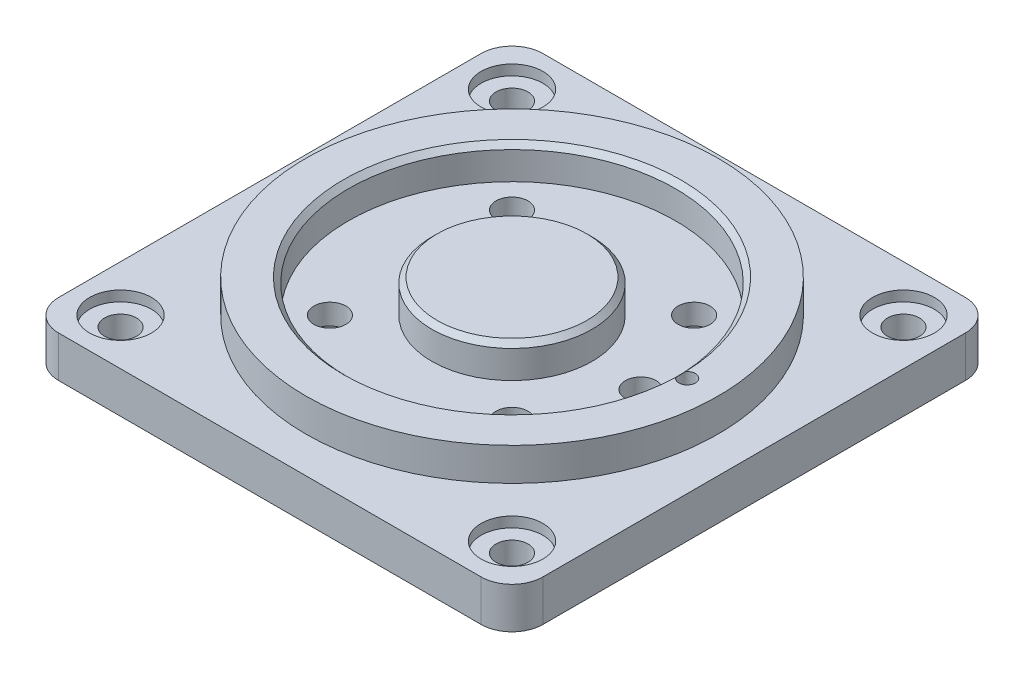
from build123d import *

# Parameters (mm, degrees)
SKETCH1_W           = 94
SKETCH1_H           = 94
SKETCH1_R           = 1.6
SKETCH1_R_2         = 3.1
SKETCH1_R_3         = 3
BOSS_EXTRUDE1_DEPTH = 8
SKETCH2_R           = 7
CUT_EXTRUDE1_DEPTH  = 4
SKETCH3_R           = 40
SKETCH3_R_2         = 1.6
SKETCH3_R_3         = 31.75
SKETCH3_R_4         = 15.55
BOSS_EXTRUDE2_DEPTH = 6.4
CHAMFER1_SIZE       = 1
FILLET1_R           = 6
SKETCH5_R           = 3.1
CUT_EXTRUDE2_DEPTH  = 67.947740825
SKETCH6_R           = 6
CUT_EXTRUDE3_DEPTH  = 2


with BuildPart() as part:
    # Sketch1 → Boss-Extrude1 (new body)
    with BuildSketch(Plane(origin=(0, 0, 0), x_dir=(1, 0, 0), z_dir=(0, 1, 0))):
        Rectangle(SKETCH1_W, SKETCH1_H)
        with Locations(Location((34, 0, 0), (0, 0, 270))):
            Circle(SKETCH1_R, mode=Mode.SUBTRACT)
        with Locations(Location((17.67766953, -17.67766953, 0), (0, 0, 270))):
            Circle(SKETCH1_R_2, mode=Mode.SUBTRACT)
        with Locations(Location((25, 0, 0), (0, 0, 270))):
            Circle(SKETCH1_R_3, mode=Mode.SUBTRACT)
        with Locations(Location((-17.67766953, -17.67766953, 0), (0, 0, 270))):
            Circle(SKETCH1_R_2, mode=Mode.SUBTRACT)
        with Locations(Location((-17.67766953, 17.67766953, 0), (0, 0, 270))):
            Circle(SKETCH1_R_2, mode=Mode.SUBTRACT)
        with Locations(Location((17.67766953, 17.67766953, 0), (0, 0, 270))):
            Circle(SKETCH1_R_2, mode=Mode.SUBTRACT)
    extrude(amount=BOSS_EXTRUDE1_DEPTH)

    # Sketch2 → Cut-Extrude1 (cut)
    with BuildSketch(Plane.XZ):
        with Locations(Location((17.67766953, 17.67766953, 0), (0, 0, 270))):
            Circle(SKETCH2_R)
        with Locations(Location((17.67766953, -17.67766953, 0), (0, 0, 270))):
            Circle(SKETCH2_R)
        with Locations(Location((-17.67766953, -17.67766953, 0), (0, 0, 270))):
            Circle(SKETCH2_R)
        with Locations(Location((-17.67766953, 17.67766953, 0), (0, 0, 270))):
            Circle(SKETCH2_R)
    extrude(amount=-CUT_EXTRUDE1_DEPTH, mode=Mode.SUBTRACT)

    # Sketch3 → Boss-Extrude2 (add)
    # profile 1 of 2: a face of its own
    with BuildSketch(Plane(origin=(0, 8, 0), x_dir=(1, 0, 0), z_dir=(0, 1, 0))):
        with Locations(Location((0, 0, 0), (0, 0, 270))):
            Circle(SKETCH3_R)
        with Locations(Location((34, 0, 0), (0, 0, 270))):
            Circle(SKETCH3_R_2, mode=Mode.SUBTRACT)
        with Locations(Location((0, 0, 0), (0, 0, 270))):
            Circle(SKETCH3_R_3, mode=Mode.SUBTRACT)
    # profile 2 of 2: a face of its own
    with BuildSketch(Plane(origin=(0, 8, 0), x_dir=(1, 0, 0), z_dir=(0, 1, 0))):
        with Locations(Location((0, 0, 0), (0, 0, 270))):
            Circle(SKETCH3_R_4)
    extrude(amount=BOSS_EXTRUDE2_DEPTH)

    # Chamfer1
    # the kernel refuses this chamfer: 1 mm, written as the material it takes off along each edge
    with BuildSketch(Plane(origin=(0, 14.4, 0), x_dir=(0, 0, 1), z_dir=(-1, 0, 0))) as chamfer1_piece_1:
        Polygon((15.55, -CHAMFER1_SIZE), (15.55 - CHAMFER1_SIZE, 0), (15.55, 0), align=None)
    revolve(axis=Axis((0, 14.4, 0), (0, 1, 0)), mode=Mode.SUBTRACT)
    with BuildSketch(Plane(origin=(0, 14.4, 0), x_dir=(0, 0, 1), z_dir=(-1, 0, 0))) as chamfer1_piece_2:
        Polygon((31.75 + CHAMFER1_SIZE, 0), (31.75, -CHAMFER1_SIZE), (31.75, 0), align=None)
    revolve(axis=Axis((0, 14.4, 0), (0, 1, 0)), mode=Mode.SUBTRACT)

    # Fillet1
    fillet1_edges = [part.edges().sort_by_distance(p)[0] for p in [
        (47, 4, 47),
        (-47, 4, 47),
        (-47, 4, -47),
        (47, 4, -47),
    ]]
    fillet(fillet1_edges, radius=FILLET1_R)

    # Sketch5 → Cut-Extrude2 (cut, through all)
    with BuildSketch(Plane(origin=(0, 8, 0), x_dir=(1, 0, 0), z_dir=(0, 1, 0))):
        with Locations(Location((-38, 38, 0), (0, 0, 270))):
            Circle(SKETCH5_R)
        with Locations(Location((38, 38, 0), (0, 0, 270))):
            Circle(SKETCH5_R)
        with Locations(Location((38, -38, 0), (0, 0, 270))):
            Circle(SKETCH5_R)
        with Locations(Location((-38, -38, 0), (0, 0, 270))):
            Circle(SKETCH5_R)
    extrude(amount=-CUT_EXTRUDE2_DEPTH, mode=Mode.SUBTRACT)

    # Sketch6 → Cut-Extrude3 (cut)
    with BuildSketch(Plane(origin=(0, 8, 0), x_dir=(1, 0, 0), z_dir=(0, 1, 0))):
        with Locations(Location((-38, 38, 0), (0, 0, 270))):
            Circle(SKETCH6_R)
        with Locations(Location((38, 38, 0), (0, 0, 270))):
            Circle(SKETCH6_R)
        with Locations(Location((38, -38, 0), (0, 0, 270))):
            Circle(SKETCH6_R)
        with Locations(Location((-38, -38, 0), (0, 0, 270))):
            Circle(SKETCH6_R)
    extrude(amount=-CUT_EXTRUDE3_DEPTH, mode=Mode.SUBTRACT)


solid = part.part
